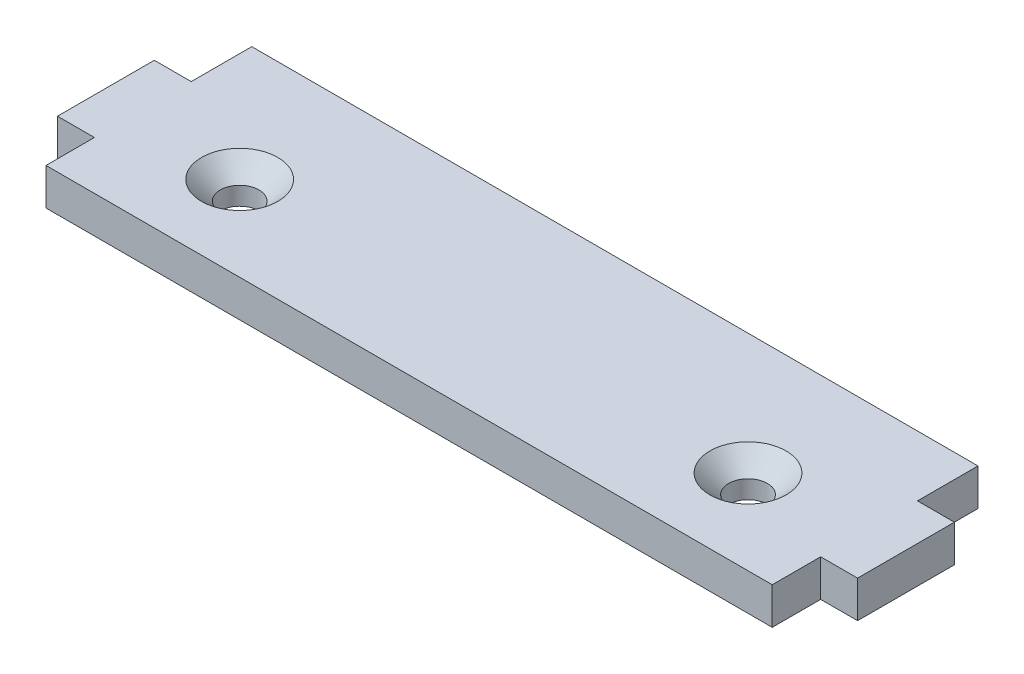
from build123d import *

# Parameters (mm, degrees)
SKETCH1_R           = 1.5
BOSS_EXTRUDE1_DEPTH = 3.05


with BuildPart() as part:
    # Sketch1 → Boss-Extrude1 (new body)
    with BuildSketch(Plane(origin=(0, 0, 0), x_dir=(1, 0, 0), z_dir=(0, 1, 0))):
        Polygon((3.05, 17), (3.05, 12), (0, 12), (0, 4), (3.05, 4), (3.05, 0), (63.05, 0), (63.05, 4), (66.1, 4), (66.1, 12), (63.05, 12), (63.05, 17), align=None)
        with Locations((54.05, 7)):
            Circle(SKETCH1_R, mode=Mode.SUBTRACT)
        with Locations((12.05, 7)):
            Circle(SKETCH1_R, mode=Mode.SUBTRACT)
    extrude(amount=BOSS_EXTRUDE1_DEPTH)

    # Sketch5 → CSK for M3 Flat Head Machine Screw1 (revolve, cut)
    with BuildSketch(Plane(origin=(12.05, 3.05, -7), x_dir=(0, 0, 1), z_dir=(1, 0, 0))):
        Polygon((0, 0), (0, 3.05), (1.6, 3.05), (1.6, 1.55), (3.15, 0), align=None)
    revolve(axis=Axis((12.05, 9.4, -7), (0, -1, 0)), mode=Mode.SUBTRACT)

    # Sketch7 → CSK for M3 Flat Head Machine Screw2 (revolve, cut)
    with BuildSketch(Plane(origin=(54.05, 3.05, -7), x_dir=(0, 0, 1), z_dir=(1, 0, 0))):
        Polygon((0, 0), (0, 3.05), (1.6, 3.05), (1.6, 1.55), (3.15, 0), align=None)
    revolve(axis=Axis((54.05, 9.4, -7), (0, -1, 0)), mode=Mode.SUBTRACT)


solid = part.part
